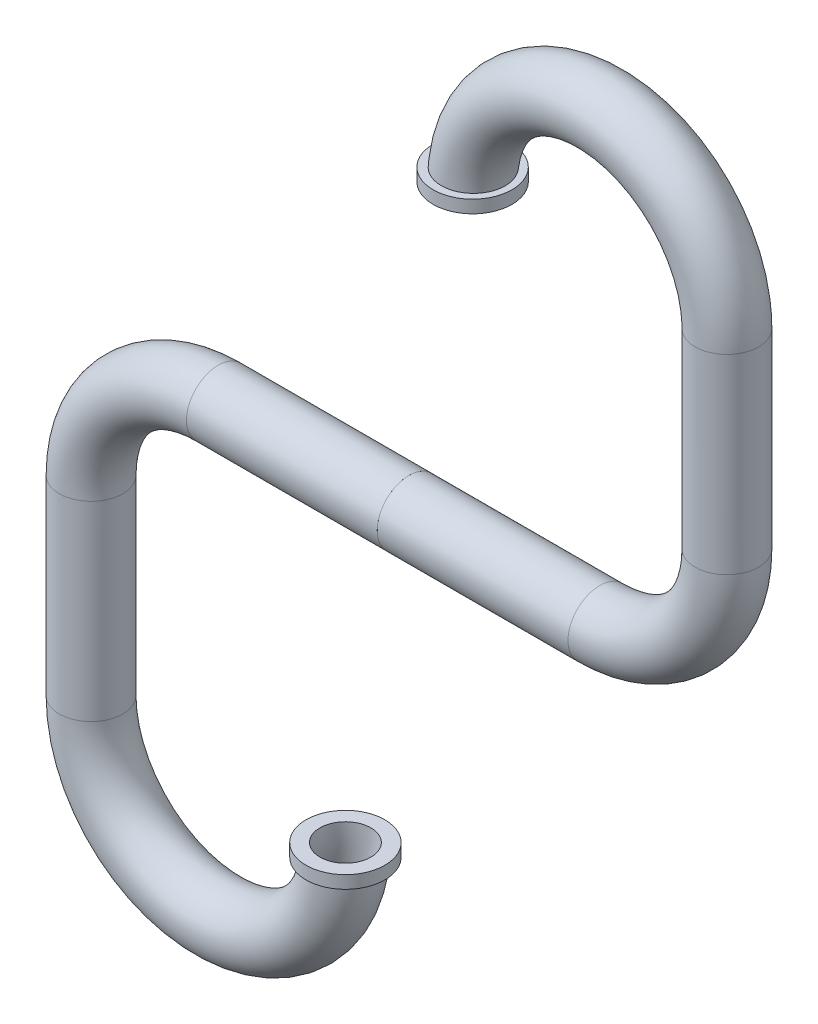
from build123d import *

# Parameters (mm, degrees)
SKETCH3_R             = 0.25
SKETCH3_R_2           = 0.2
SKETCH6_R             = 0.31
SKETCH6_R_2           = 0.21
BODY_MOVE_COPY1_ANGLE = 180


# Read off the part's stored shape, not the designer's step: Split1
with BuildPart() as part:
    # Sweep-Thin1: sweep along a path in Sketch1
    with BuildLine(Plane.XY) as sweep_thin1_path:
        Line((0.5, -2.5), (-1, -2.5))
        ThreePointArc((-1, -2.5), (-1.707106781, -2.207106781), (-2, -1.5))
        Line((-2, -1.5), (-2, 0))
        ThreePointArc((-2, 0), (-1, 1), (0, 0))
    # Sketch3 → Sweep-Thin1 (sweep)
    with BuildSketch(Plane(origin=(0, 0, 0), x_dir=(1, 0, 0), z_dir=(0, 1, 0))):
        Circle(SKETCH3_R)
        Circle(SKETCH3_R_2, mode=Mode.SUBTRACT)
    sweep(path=sweep_thin1_path.line)

    # Sweep-Thin2: sweep along a path in Sketch5
    with BuildLine(Plane.XY) as sweep_thin2_path:
        Line((0, 0), (0, 0.1))
    # Sketch6 → Sweep-Thin2 (sweep)
    with BuildSketch(Plane(origin=(0, 0, 0), x_dir=(1, 0, 0), z_dir=(0, 1, 0))):
        Circle(SKETCH6_R)
        Circle(SKETCH6_R_2, mode=Mode.SUBTRACT)
    sweep(path=sweep_thin2_path.line)

    # Mirror2: part across plane


with BuildPart() as part_1:
    add(part.part)
    add(part.part.mirror(Plane(origin=(0.5, -2.5, 0), x_dir=(0, 0, 1), z_dir=(1, 0, 0))))


with BuildPart() as body_2:
    # Split1: the piece on the far side of the plane
    add(part_1.part)
    split(bisect_by=Plane.YZ.offset(0.5), keep=Keep.BOTTOM)


with BuildPart() as part_2:
    add(part_1.part)

    # Split1
    split(bisect_by=Plane.YZ.offset(0.5), keep=Keep.TOP)


with BuildPart() as body_2_1:
    # Body-Move/Copy1: moved
    add(body_2.part.rotate(Axis((0, -2.5, 0), (1, 0, 0)), BODY_MOVE_COPY1_ANGLE))


solid = Compound([part_2.part, body_2_1.part])
